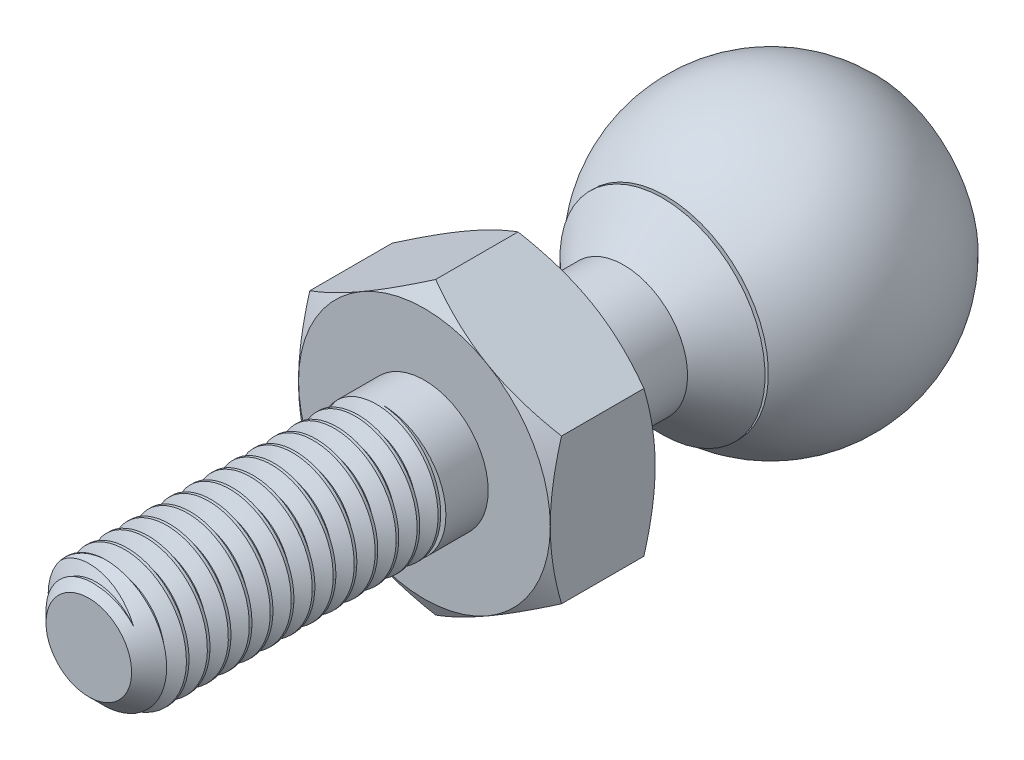
from build123d import *

# Parameters (mm, degrees)
CUT_EXTRUDE3_DEPTH      = 20.86609247
CUT_EXTRUDE3_DEPTH_BACK = 20.86609247
SKETCH8_W               = 1.58115
SKETCH8_H               = 18.2499
CUT_EXTRUDE4_DEPTH      = 20.86609247
CUT_EXTRUDE4_DEPTH_BACK = 20.86609247
SKETCH10_R              = 2.413
CHAMFER1_SIZE           = 0.2413
SKETCH12_W              = 11.0998
SKETCH12_H              = 2.413
CHAMFER3_SIZE           = 0.79375
CUT_SWEEP2_PITCH        = 0.79375
SKETCH15_W              = 18.67535
SKETCH15_H              = 2.413
EXTRUDE1_DEPTH          = 3.96875
SKETCH17_OUTSIDE_W      = 116.006
SKETCH17_OUTSIDE_H      = 116.006
SKETCH17_OUTSIDE_R      = 4.7625
CUT_EXTRUDE5_DEPTH      = 27.681787229
CUT_EXTRUDE5_DRAFT      = -60
SKETCH18_OUTSIDE_W      = 111.33
SKETCH18_OUTSIDE_H      = 111.33
SKETCH18_OUTSIDE_R      = 4.7625
CUT_EXTRUDE6_DEPTH      = 26.33194564
CUT_EXTRUDE6_DRAFT      = -60


with BuildPart() as part:
    # Sketch7 → Revolve3 (revolve)
    with BuildSketch(Plane.XY):
        with BuildLine():
            Line((0, 18.2499), (0, 7.1501))
            ThreePointArc((0, 7.1501), (5.5499, 12.7), (0, 18.2499))
        make_face()
    revolve(axis=Axis((0, 0, 0), (0, 1, 0)))

    # Sketch8 → Cut-Extrude3 (cut, two sides: drawn at the far end of the back side and taken through both)
    with BuildSketch(Plane(origin=(0, 0, 0), x_dir=(0, 0, -1), z_dir=(1, 0, 0)).offset(-CUT_EXTRUDE3_DEPTH_BACK)):
        with Locations((-4.759325, 9.12495)):
            Rectangle(SKETCH8_W, SKETCH8_H)
        with Locations((4.759325, 9.12495)):
            Rectangle(SKETCH8_W, SKETCH8_H)
    extrude(amount=CUT_EXTRUDE3_DEPTH + CUT_EXTRUDE3_DEPTH_BACK, mode=Mode.SUBTRACT)

    # Sketch10 → Cut-Extrude4 (cut, two sides: drawn at the far end of the back side and taken through both)
    with BuildSketch(Plane.XY.offset(-CUT_EXTRUDE4_DEPTH_BACK)):
        with Locations((0, 12.7)):
            Circle(SKETCH10_R)
    extrude(amount=CUT_EXTRUDE4_DEPTH + CUT_EXTRUDE4_DEPTH_BACK, mode=Mode.SUBTRACT)

    # Chamfer1
    chamfer1_edges = [part.edges().sort_by_distance(p)[0] for p in [
        (-2.413, 12.7, -3.96875),
        (-2.413, 12.7, 3.96875),
    ]]
    chamfer(chamfer1_edges, length=CHAMFER1_SIZE)


with BuildPart() as body_2:
    # Sketch12 → Revolve4 (revolve)
    with BuildSketch(Plane(origin=(0, 0, 0), x_dir=(0, 0, -1), z_dir=(1, 0, 0)), mode=Mode.PRIVATE) as revolve4_sk:
        with Locations((-20.2565, 13.9065)):
            Rectangle(SKETCH12_W, SKETCH12_H)
    revolve(revolve4_sk.sketch.rotate(Axis((0, 12.7, -3.96875), (0, 0, -1)), 180), axis=Axis((0, 12.7, -3.96875), (0, 0, -1)))

    # Chamfer3
    chamfer3_edges = [body_2.edges().sort_by_distance(p)[0] for p in [
        (0, 15.113, 25.8064),
    ]]
    chamfer(chamfer3_edges, length=CHAMFER3_SIZE)

    # Cut-Sweep2: the profile of Sketch24 profile screwed along a left-hand helix of 20.384 turns, 8 arcs to a turn; built about Z, then put on its axis
    cut_sweep2_z = Axis((0, 0, 0), (0, 0, 1))
    cut_sweep2_corners = [(0, -2.4133, 0.000173205), (0, -2.4133, -0.694704455), (0, -1.897444252, -0.396875), (0, -1.897444252, -0.29765625)]
    with BuildLine(mode=Mode.PRIVATE) as cut_sweep2_profile:
        Line(cut_sweep2_corners[0], cut_sweep2_corners[1])
        Line(cut_sweep2_corners[1], cut_sweep2_corners[2])
        Line(cut_sweep2_corners[2], cut_sweep2_corners[3])
        Line(cut_sweep2_corners[3], cut_sweep2_corners[0])
    cut_sweep2_cap = Face(cut_sweep2_profile.wire())
    cut_sweep2_turn_angles = [0, -22.5, -45, -67.5, -90, -112.5, -135, -157.5, -180, -202.5, -225, -247.5, -270, -292.5, -315, -337.5, -360]
    cut_sweep2_turn_weights = [1, 0.9238795325112867, 1, 0.9238795325112867, 1, 0.9238795325112867, 1, 0.9238795325112867, 1, 0.9238795325112867, 1, 0.9238795325112867, 1, 0.9238795325112867, 1, 0.9238795325112867, 1]
    cut_sweep2_turn_rails = [Edge.make_bspline([Vector(p[0], p[1], 0).rotate(cut_sweep2_z, cut_sweep2_turn_angles[k]) / cut_sweep2_turn_weights[k] + Vector(0, 0, p[2] + -CUT_SWEEP2_PITCH * cut_sweep2_turn_angles[k] / 360) for k in range(17)], [0, 0, 0, 1, 1, 2, 2, 3, 3, 4, 4, 5, 5, 6, 6, 7, 7, 8, 8, 8], 2, cut_sweep2_turn_weights) for p in cut_sweep2_corners]
    cut_sweep2_turn_sides = [Face.make_surface_from_curves(cut_sweep2_turn_rails[p[0]], cut_sweep2_turn_rails[p[1]]) for p in [(0, 1), (1, 2), (2, 3), (3, 0)]]
    cut_sweep2_last_angles = [-7200, -7222.5, -7245, -7267.5, -7290, -7312.5, -7335, -7336.62, -7338.24]
    cut_sweep2_last_weights = [1, 0.9238795325112867, 1, 0.9238795325112867, 1, 0.9238795325112867, 1, 0.9996003076502521, 1]
    cut_sweep2_last_rails = [Edge.make_bspline([Vector(p[0], p[1], 0).rotate(cut_sweep2_z, cut_sweep2_last_angles[k]) / cut_sweep2_last_weights[k] + Vector(0, 0, p[2] + -CUT_SWEEP2_PITCH * cut_sweep2_last_angles[k] / 360) for k in range(9)], [0, 0, 0, 1, 1, 2, 2, 3, 3, 4, 4, 4], 2, cut_sweep2_last_weights) for p in cut_sweep2_corners]
    cut_sweep2_last_sides = [Face.make_surface_from_curves(cut_sweep2_last_rails[p[0]], cut_sweep2_last_rails[p[1]]) for p in [(0, 1), (1, 2), (2, 3), (3, 0)]]
    cut_sweep2 = Plane(origin=(0, 12.7, 14.7066), x_dir=(-1, 0, 0), z_dir=(0, 0, 1)) * Solid(Shell([*[p.moved(Location((0, 0, CUT_SWEEP2_PITCH * i))) for i in range(20) for p in cut_sweep2_turn_sides], *cut_sweep2_last_sides, cut_sweep2_cap, cut_sweep2_cap.rotate(cut_sweep2_z, -7338.24).moved(Location((0, 0, -CUT_SWEEP2_PITCH * -7338.24 / 360)))]))
    add(cut_sweep2, mode=Mode.SUBTRACT)

    # Sketch15 → Revolve5 (revolve)
    with BuildSketch(Plane(origin=(0, 0, 0), x_dir=(0, 0, -1), z_dir=(1, 0, 0)), mode=Mode.PRIVATE) as revolve5_sk:
        with Locations((-5.368925, 13.9065)):
            Rectangle(SKETCH15_W, SKETCH15_H)
    revolve(revolve5_sk.sketch.rotate(Axis((0, 12.7, -3.96875), (0, 0, -1)), 90), axis=Axis((0, 12.7, -3.96875), (0, 0, -1)))

    # Sketch16 → Extrude1 (add)
    with BuildSketch(Plane.XY.offset(13.1064)):
        Polygon((0, 18.199261314), (-4.7625, 15.449630657), (-4.7625, 9.950369343), (0, 7.200738686), (4.7625, 9.950369343), (4.7625, 15.449630657), align=None)
    extrude(amount=-EXTRUDE1_DEPTH)


with BuildPart() as cut_extrude5_tool:
    # Sketch17 outside → Cut-Extrude5 (with draft: the straight prism first)
    with BuildSketch(Plane.XY.offset(13.1064)):
        with Locations((0, 12.7)):
            Rectangle(SKETCH17_OUTSIDE_W, SKETCH17_OUTSIDE_H)
        with Locations((0, 12.7)):
            Circle(SKETCH17_OUTSIDE_R, mode=Mode.SUBTRACT)
    extrude(amount=-CUT_EXTRUDE5_DEPTH)
    # Cut-Extrude5: the draft: its side faces are tilted about the plane it starts from
    cut_extrude5_sides = [cut_extrude5_tool.faces().sort_by_distance(p)[0] for p in [
        (0, -45.303, -0.734493614),
        (58.003, 12.7, -0.734493614),
        (0, 70.703, -0.734493614),
        (-58.003, 12.7, -0.734493614),
        (-4.7625, 12.7, -0.734493614),
    ]]
    draft(cut_extrude5_sides, Plane.XY.offset(13.1064), CUT_EXTRUDE5_DRAFT)


with BuildPart() as body_2_1:
    add(body_2.part)

    # Cut-Extrude5: cut by cut_extrude5_tool
    add(cut_extrude5_tool.part, mode=Mode.SUBTRACT)


with BuildPart() as cut_extrude6_tool:
    # Sketch18 outside → Cut-Extrude6 (with draft: the straight prism first)
    with BuildSketch(Plane(origin=(0, 0, 9.13765), x_dir=(-1, 0, 0), z_dir=(0, 0, -1))):
        with Locations((0, 12.7)):
            Rectangle(SKETCH18_OUTSIDE_W, SKETCH18_OUTSIDE_H)
        with Locations((0, 12.7)):
            Circle(SKETCH18_OUTSIDE_R, mode=Mode.SUBTRACT)
    extrude(amount=-CUT_EXTRUDE6_DEPTH)
    # Cut-Extrude6: the draft: its side faces are tilted about the plane it starts from
    cut_extrude6_sides = [cut_extrude6_tool.faces().sort_by_distance(p)[0] for p in [
        (0, -42.965, 22.30362282),
        (-55.665, 12.7, 22.30362282),
        (0, 68.365, 22.30362282),
        (55.665, 12.7, 22.30362282),
        (4.7625, 12.7, 22.30362282),
    ]]
    draft(cut_extrude6_sides, Plane(origin=(0, 0, 9.13765), x_dir=(-1, 0, 0), z_dir=(0, 0, -1)), CUT_EXTRUDE6_DRAFT)


with BuildPart() as body_2_2:
    add(body_2_1.part)

    # Cut-Extrude6: cut by cut_extrude6_tool
    add(cut_extrude6_tool.part, mode=Mode.SUBTRACT)

    # Sketch20 → Revolve6 (revolve)
    with BuildSketch(Plane(origin=(0, 0, 0), x_dir=(0, 0, -1), z_dir=(1, 0, 0)), mode=Mode.PRIVATE) as revolve6_sk:
        Polygon((-4.09575, 16.579486235), (-5.562236235, 15.113), (-4.09575, 15.113), align=None)
    revolve(revolve6_sk.sketch.rotate(Axis((0, 12.7, -3.96875), (0, 0, 1)), 270), axis=Axis((0, 12.7, -3.96875), (0, 0, 1)))


solid = Compound([part.part, body_2_2.part])
